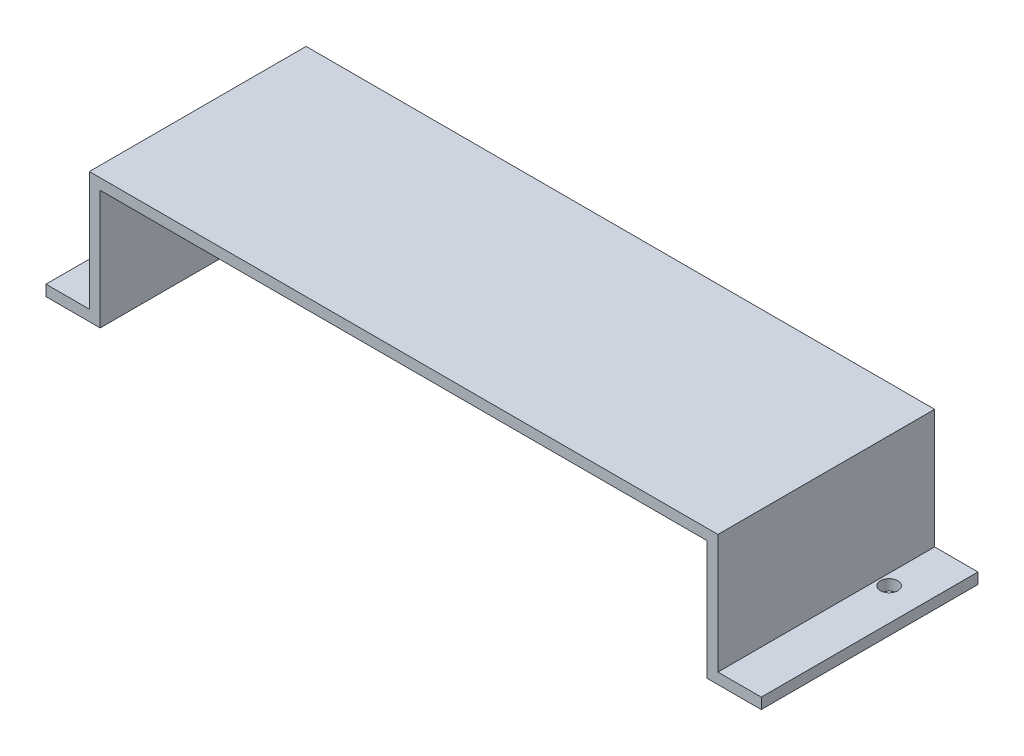
from build123d import *

# Parameters (mm, degrees)
SKETCH1_W           = 177.8
SKETCH1_H           = 63.5
BOSS_EXTRUDE1_DEPTH = 3.175
SKETCH3_W           = 3.175
SKETCH3_H           = 63.5
BOSS_EXTRUDE2_DEPTH = 38.1
SKETCH4_W           = 63.5
SKETCH4_H           = 3.175
BOSS_EXTRUDE3_DEPTH = 12.7
SKETCH5_R           = 2.54
CUT_EXTRUDE1_DEPTH  = 12.7


with BuildPart() as part:
    # Sketch1 → Boss-Extrude1 (new body)
    with BuildSketch(Plane(origin=(0, 0, 0), x_dir=(1, 0, 0), z_dir=(0, 1, 0))):
        Rectangle(SKETCH1_W, SKETCH1_H)
    extrude(amount=BOSS_EXTRUDE1_DEPTH)

    # Sketch3 → Boss-Extrude2 (add)
    with BuildSketch(Plane(origin=(0, 3.175, 0), x_dir=(1, 0, 0), z_dir=(0, 1, 0))):
        with Locations((-90.4875, 0)):
            Rectangle(SKETCH3_W, SKETCH3_H)
        with Locations((90.4875, 0)):
            Rectangle(SKETCH3_W, SKETCH3_H)
    extrude(amount=-BOSS_EXTRUDE2_DEPTH)

    # Sketch4 → Boss-Extrude3 (add)
    with BuildSketch(Plane(origin=(92.075, 0, 0), x_dir=(0, 0, -1), z_dir=(1, 0, 0))):
        with Locations((0, -33.3375)):
            Rectangle(SKETCH4_W, SKETCH4_H)
    boss_extrude3 = extrude(amount=BOSS_EXTRUDE3_DEPTH)

    # Sketch5 → Cut-Extrude1 (cut)
    with BuildSketch(Plane.XZ.offset(34.925)):
        with Locations((95.25, -15.24)):
            Circle(SKETCH5_R)
    cut_extrude1 = extrude(amount=-CUT_EXTRUDE1_DEPTH, mode=Mode.SUBTRACT)

    # Mirror1: Boss-Extrude3, Cut-Extrude1 across plane
    add(boss_extrude3.mirror(Plane(origin=(0, 0, 0), x_dir=(0, 0, 1), z_dir=(1, 0, 0))))
    add(cut_extrude1.mirror(Plane(origin=(0, 0, 0), x_dir=(0, 0, 1), z_dir=(1, 0, 0))), mode=Mode.SUBTRACT)


solid = part.part
